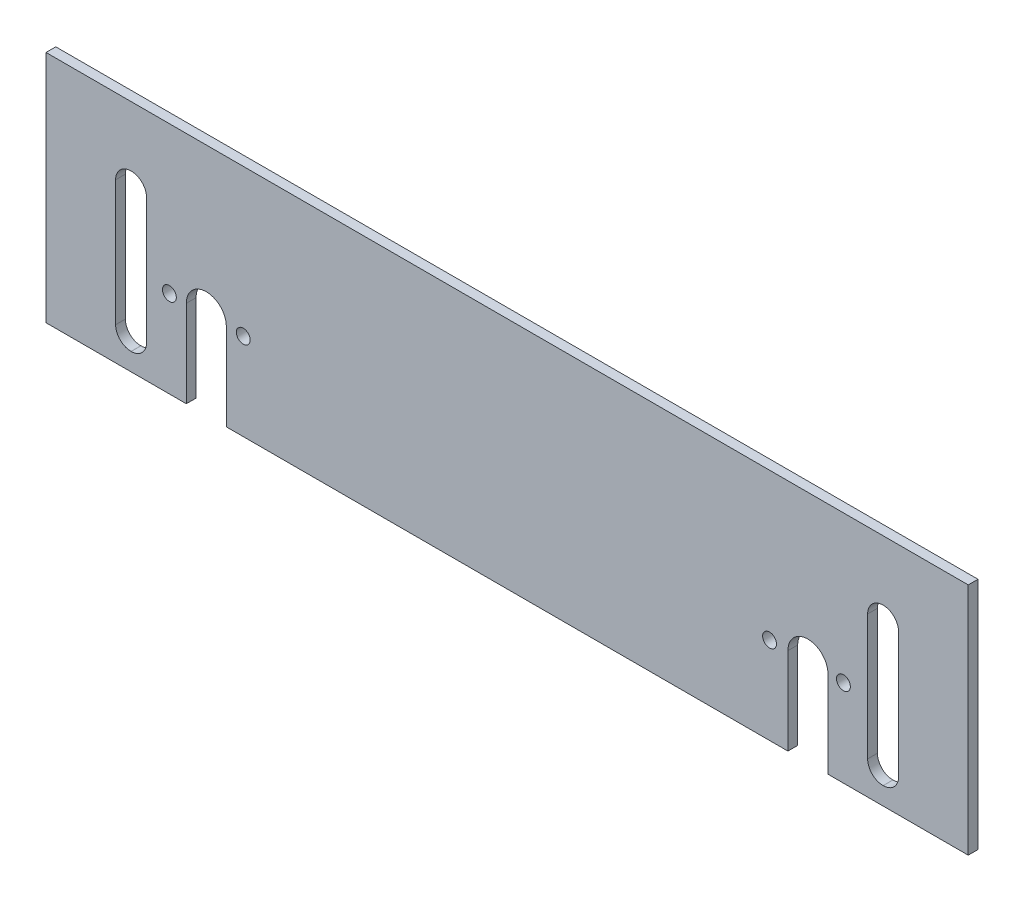
from build123d import *

# Parameters (mm, degrees)
SKETCH1_W            = 299.7
SKETCH1_H            = 76.075
BOSS_EXTRUDE1_DEPTH  = 3.175
CUT_EXTRUDE1_DEPTH   = 155.634907221
M4_CLEARANCE_HOLE1_D = 4.5
CUT_EXTRUDE4_DEPTH   = 155.634907221


with BuildPart() as part:
    # Sketch1 → Boss-Extrude1 (new body)
    with BuildSketch(Plane.XY):
        Rectangle(SKETCH1_W, SKETCH1_H)
    extrude(amount=BOSS_EXTRUDE1_DEPTH)

    # Sketch3 → Cut-Extrude1 (cut, through all)
    with BuildSketch(Plane(origin=(0, 0, 0), x_dir=(-1, 0, 0), z_dir=(0, 0, -1))):
        with BuildLine():
            Line((-104.25, -38.0375), (-91.25, -38.0375))
            Line((-91.25, -38.0375), (-91.25, -9.7625))
            ThreePointArc((-91.25, -9.7625), (-97.75, -3.2625), (-104.25, -9.7625))
            Line((-104.25, -9.7625), (-104.25, -38.0375))
        make_face()
        with BuildLine():
            ThreePointArc((104.25, -9.7625), (97.75, -3.2625), (91.25, -9.7625))
            Line((91.25, -9.7625), (91.25, -38.0375))
            Line((91.25, -38.0375), (104.25, -38.0375))
            Line((104.25, -38.0375), (104.25, -9.7625))
        make_face()
    extrude(amount=-CUT_EXTRUDE1_DEPTH, mode=Mode.SUBTRACT)

    # M4 Clearance Hole1 (through all)
    with Locations(Plane(origin=(0, 0, 0), x_dir=(-1, 0, 0), z_dir=(0, 0, -1))):
        with Locations((-109.288, -9.7625), (-85.288, -9.7625), (85.75, -9.7625), (109.75, -9.7625)):
            Hole(M4_CLEARANCE_HOLE1_D / 2)

    # Sketch8 → Cut-Extrude4 (cut, through all)
    with BuildSketch(Plane.XY.offset(3.175)):
        with BuildLine():
            Line((122.1609, 18.5125), (122.2247, 18.5125))
            ThreePointArc((122.2247, 18.5125), (125.760233906, 17.048033906), (127.2247, 13.5125))
            Line((127.2247, 13.5125), (127.2247, -27.282435401))
            ThreePointArc((127.2247, -27.282435401), (125.760233906, -30.817969307), (122.2247, -32.282435401))
            Line((122.2247, -32.282435401), (122.1609, -32.282435401))
            ThreePointArc((122.1609, -32.282435401), (118.625366094, -30.817969307), (117.1609, -27.282435401))
            Line((117.1609, -27.282435401), (117.1609, 13.5125))
            ThreePointArc((117.1609, 13.5125), (118.625366094, 17.048033906), (122.1609, 18.5125))
        make_face()
    cut_extrude4 = extrude(amount=-CUT_EXTRUDE4_DEPTH, mode=Mode.SUBTRACT)

    # Mirror3: Cut-Extrude4 across plane
    add(cut_extrude4.mirror(Plane(origin=(0, 0, 0), x_dir=(0, 0, 1), z_dir=(1, 0, 0))), mode=Mode.SUBTRACT)


solid = part.part
